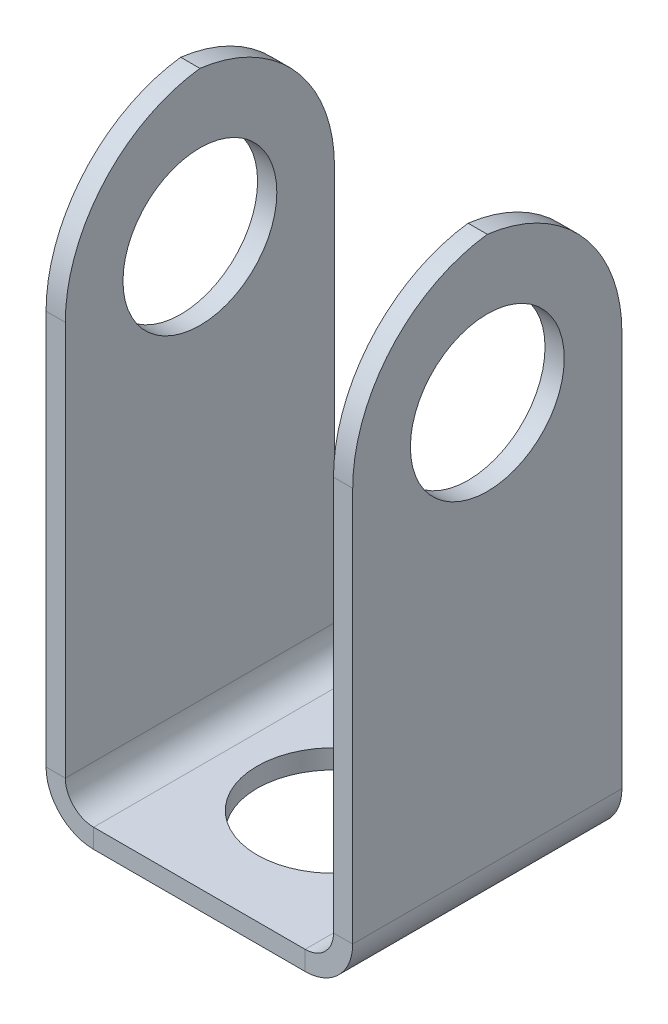
from build123d import *

# Parameters (mm, degrees)
SKETCH1_W          = 5.5
SKETCH1_H          = 7
BASE_FLANGE1_DEPTH = 0.5
EDGE_FLANGE1_DEPTH = 7
EDGE_FLANGE2_DEPTH = 7
FILLET1_R          = 4
SKETCH12_R         = 2
CUT_EXTRUDE1_DEPTH = 16.880893326
SKETCH13_R         = 2
CUT_EXTRUDE2_DEPTH = 18.75106584


# Sheet-metal steps are written as plain solids
with BuildPart() as part:
    # Sketch1 → Base-Flange1 (new body)
    with BuildSketch(Plane(origin=(0, 0, 0), x_dir=(1, 0, 0), z_dir=(0, 1, 0))):
        Rectangle(SKETCH1_W, SKETCH1_H)
    extrude(amount=BASE_FLANGE1_DEPTH)

    # Edge-Flange1 section (across the edge) → Edge-Flange1 (add)
    with BuildSketch(Plane(origin=(3.4866, 0.5, 3.5), x_dir=(-1, 0, 0), z_dir=(0, 0, -1))):
        with BuildLine():
            Line((-0.5, 0.7366), (-0.5, 15))
            Line((-0.5, 15), (0, 15))
            Line((0, 15), (0, 0.7366))
            ThreePointArc((0, 0.7366), (0.215745145, 0.215745145), (0.7366, 0))
            Line((0.7366, 0), (0.7366, -0.5))
            ThreePointArc((0.7366, -0.5), (-0.137808246, -0.137808246), (-0.5, 0.7366))
        make_face()
    extrude(amount=EDGE_FLANGE1_DEPTH)

    # Edge-Flange2 section (across the edge) → Edge-Flange2 (add)
    with BuildSketch(Plane(origin=(-3.4866, 0.5, -3.5), x_dir=(1, 0, 0), z_dir=(0, 0, 1))):
        with BuildLine():
            Line((-0.5, 0.7366), (-0.5, 15))
            Line((-0.5, 15), (0, 15))
            Line((0, 15), (0, 0.7366))
            ThreePointArc((0, 0.7366), (0.215745145, 0.215745145), (0.7366, 0))
            Line((0.7366, 0), (0.7366, -0.5))
            ThreePointArc((0.7366, -0.5), (-0.137808246, -0.137808246), (-0.5, 0.7366))
        make_face()
    extrude(amount=EDGE_FLANGE2_DEPTH)

    # Fillet1
    # the kernel refuses this fillet: 4 mm, written as the material it takes off along each edge
    with BuildSketch(Plane(origin=(13.9866, 15.5, -3.5), x_dir=(0, -1, 0), z_dir=(-1, 0, 0)), Plane(origin=(13.9866, 15.5, 3.5), x_dir=(0, 0, -1), z_dir=(-1, 0, 0))) as fillet1_piece_1:
        with BuildLine():
            CenterArc((FILLET1_R, FILLET1_R), FILLET1_R, 180, 90)
            Line((0, FILLET1_R), (0, 0))
            Line((0, 0), (FILLET1_R, 0))
        make_face()
    extrude(amount=20.5, mode=Mode.SUBTRACT)
    with BuildSketch(Plane(origin=(-13.9866, 15.5, -3.5), x_dir=(0, -1, 0), z_dir=(1, 0, 0)), Plane(origin=(-13.9866, 15.5, 3.5), x_dir=(0, 0, -1), z_dir=(1, 0, 0))) as fillet1_piece_2:
        with BuildLine():
            CenterArc((FILLET1_R, -FILLET1_R), FILLET1_R, 90, 90)
            Line((0, -FILLET1_R), (0, 0))
            Line((0, 0), (FILLET1_R, 0))
        make_face()
    extrude(amount=20.5, mode=Mode.SUBTRACT)

    # Sketch12 → Cut-Extrude1 (cut, through all)
    with BuildSketch(Plane(origin=(0, 0.5, 0), x_dir=(1, 0, 0), z_dir=(0, 1, 0))):
        with Locations(Location((0, 0, 0), (0, 0, 270))):
            Circle(SKETCH12_R)
    extrude(amount=-CUT_EXTRUDE1_DEPTH, mode=Mode.SUBTRACT)

    # Sketch13 → Cut-Extrude2 (cut, through all)
    with BuildSketch(Plane(origin=(3.9866, 0, 0), x_dir=(0, 0, -1), z_dir=(1, 0, 0))):
        with Locations(Location((0, 11.678062377, 0), (0, 0, 90))):
            Circle(SKETCH13_R)
    extrude(amount=-CUT_EXTRUDE2_DEPTH, mode=Mode.SUBTRACT)


solid = part.part
